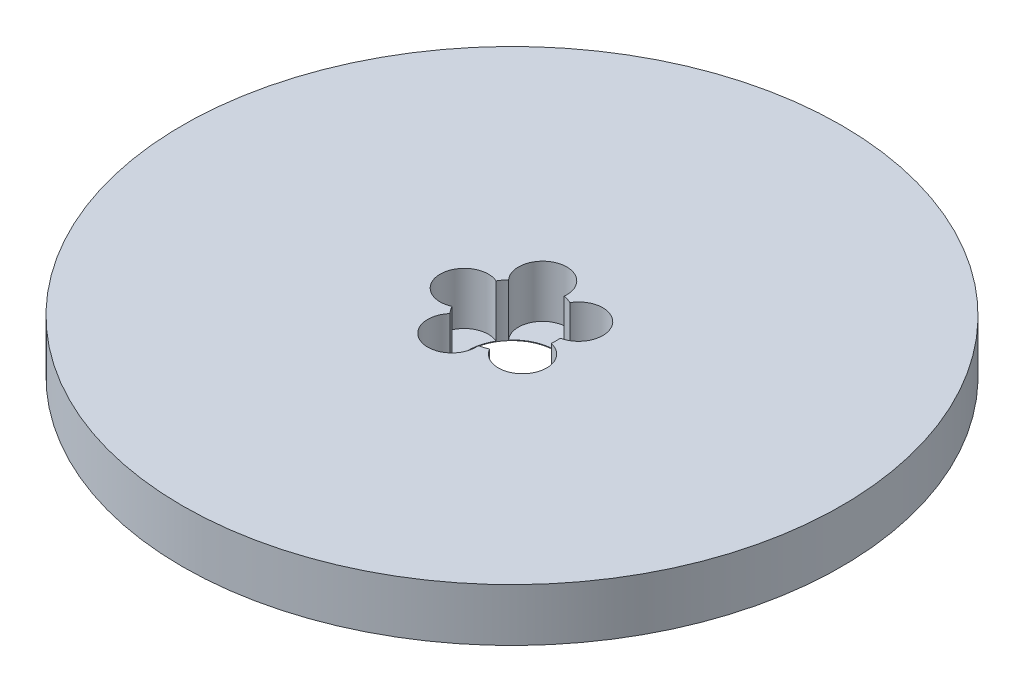
from build123d import *

# Parameters (mm, degrees)
SKETCH1_R           = 37.5
BOSS_EXTRUDE1_DEPTH = 6
SKETCH2_R           = 5
CUT_EXTRUDE1_DEPTH  = 54.371340624
SKETCH3_R           = 2.746770978
CUT_EXTRUDE2_DEPTH  = 5.932173135
CIRPATTERN1_COUNT   = 5


with BuildPart() as part:
    # Sketch1 → Boss-Extrude1 (new body)
    with BuildSketch(Plane(origin=(0, 0, 0), x_dir=(1, 0, 0), z_dir=(0, 1, 0))):
        Circle(SKETCH1_R)
    extrude(amount=BOSS_EXTRUDE1_DEPTH)

    # Sketch2 → Cut-Extrude1 (cut, through all)
    with BuildSketch(Plane(origin=(0, 0, 0), x_dir=(1, 0, 0), z_dir=(0, 1, 0))):
        Circle(SKETCH2_R)
    extrude(amount=CUT_EXTRUDE1_DEPTH, mode=Mode.SUBTRACT)

    # Sketch3 → Cut-Extrude2 (cut)
    with BuildSketch(Plane(origin=(0, 6, 0), x_dir=(1, 0, 0), z_dir=(0, 1, 0))):
        with Locations((-5.428768432, 0)):
            Circle(SKETCH3_R)
    cut_extrude2 = extrude(amount=-CUT_EXTRUDE2_DEPTH, mode=Mode.SUBTRACT)

    # CirPattern1: Cut-Extrude2 ×5 about axis
    cirpattern1_axis = Axis((0, 0, 0), (0, 1, 0))
    for i in range(1, CIRPATTERN1_COUNT):
        add(cut_extrude2.rotate(cirpattern1_axis, i * 360 / CIRPATTERN1_COUNT), mode=Mode.SUBTRACT)


solid = part.part
